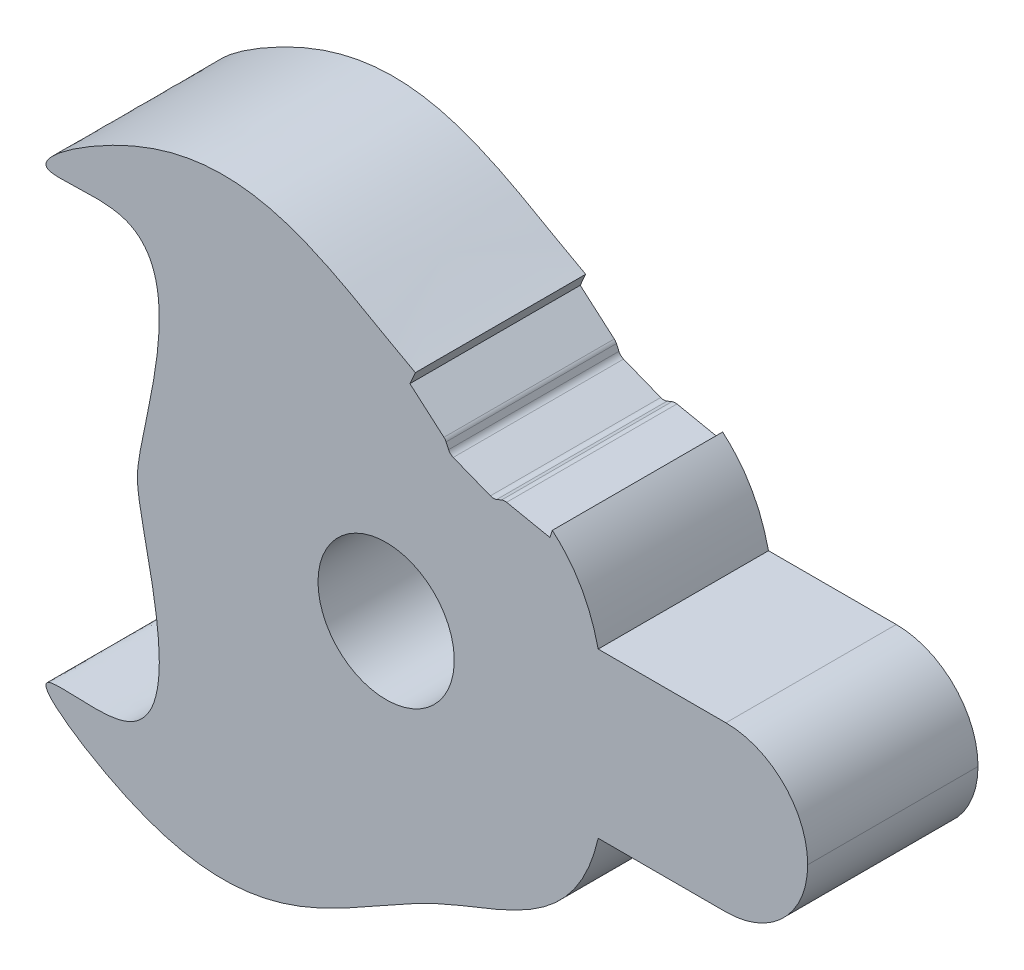
from build123d import *

# Parameters (mm, degrees)
BOSS_EXTRUDE1_DEPTH = 10
MIRROR1_START       = -10
MIRROR1_DEPTH       = 20
CUT_EXTRUDE1_DEPTH  = 79.57532019
FILLET1_R           = 1


# Read off the part's stored shape, not the designer's step: Mirror1
with BuildPart() as part:
    # Sketch1 → Boss-Extrude1 (new, symmetric)
    with BuildSketch(Plane.XY):
        with BuildLine():
            Line((42.41, 9.62), (57.41, 9.62))
            ThreePointArc((57.41, 9.62), (64.198225099, 6.808225099), (67.01, 0.02))
            Line((67.01, 0.02), (25.51, 0.02))
            ThreePointArc((25.51, 0.02), (17.499999992, 8.01999375), (9.510025, 0))
            Line((9.510025, 0), (-11.692847795, 0))
            add(Edge.make_bspline(
                [(-11.692847795, 0), (-11.839277556, 4.894472517), (-2.355639219, 29.34999023), (-27.884478287, 24.143418689), (0.622807134, 43.544120574), (18.657131981, 24.203742691), (39.848963257, 20.777562122), (42.41, 9.62)],
                knots=[0, 0, 0, 0, 0.241060169, 0.319997533, 0.433242816, 0.773278375, 1, 1, 1, 1], degree=3))
        make_face()
    extrude(amount=BOSS_EXTRUDE1_DEPTH, both=True)

    # Mirror1 outline → Mirror1 (add)
    with BuildSketch(Plane.XY.offset(MIRROR1_START)):
        with BuildLine():
            add(Edge.make_bspline(
                [(42.41, -9.62), (39.848963257, -20.777562122), (18.657131981, -24.203742691), (0.914766667, -43.231017215), (-22.484260342, -27.806120254), (-22.43062965, -26.474908489)],
                knots=[0, 0, 0, 0, 0.226721625, 0.566757184, 0.668993837, 0.668993837, 0.668993837, 0.668993837], degree=3))
            Line((42.41, -9.62), (57.41, -9.62))
            ThreePointArc((57.41, -9.62), (64.198225099, -6.808225099), (67.01, -0.02))
            ThreePointArc((67.01, -0.02), (67.009979167, 4.4e-08), (67.01, 0.02))
            Line((67.01, 0.02), (25.51, 0.02))
            ThreePointArc((25.51, 0.02), (17.520000008, -7.97999375), (9.510025, 0))
            Line((9.510025, 0), (-11.692847795, 0))
            add(Edge.make_bspline(
                [(-11.69340369, 0.019999944), (-11.693231778, 0.013308434), (-11.693046499, 0.006641761), (-11.692847795, 0)],
                knots=[0.999672883, 0.999672883, 0.999672883, 0.999672883, 1, 1, 1, 1], degree=3))
            add(Edge.make_bspline(
                [(-11.695042587, -0.13418822), (-11.695226889, -0.081424948), (-11.694688722, -0.030018581), (-11.69340369, 0.019999944)],
                knots=[0.997227707, 0.997227707, 0.997227707, 0.997227707, 0.999672882, 0.999672882, 0.999672882, 0.999672882], degree=3))
            add(Edge.make_bspline(
                [(-9.12723532, -17.435743902), (-9.132715139, -11.176519442), (-11.70604962, -3.23520175), (-11.695042587, -0.13418822)],
                knots=[0.852230655, 0.852230655, 0.852230655, 0.852230655, 0.997849686, 0.997849686, 0.997849686, 0.997849686], degree=3))
            add(Edge.make_bspline(
                [(-22.43062965, -26.474908489), (-22.436909809, -26.313315801), (-21.919544565, -25.3199587), (-11.08123689, -27.530416611), (-9.130740001, -21.42777497), (-9.12723532, -17.435743902)],
                knots=[0.667986412, 0.667986412, 0.667986412, 0.667986412, 0.680002467, 0.758939831, 0.851920313, 0.851920313, 0.851920313, 0.851920313], degree=3))
        make_face()
    extrude(amount=MIRROR1_DEPTH)

    # Sketch2 → Cut-Extrude1 (cut, through all)
    with BuildSketch(Plane.XY.offset(10)):
        Polygon((37.6, 20.83), (36.745678156, 18.13), (31.357208476, 19.231995691), (30.127421317, 18.724063538), (25.012174142, 20.745015378), (24.461632455, 21.956326808), (20.301183061, 25.553639811), (20.94, 26.998739433), align=None)
    extrude(amount=-CUT_EXTRUDE1_DEPTH, mode=Mode.SUBTRACT)

    # Fillet1
    fillet1_edges = [part.edges().sort_by_distance(p)[0] for p in [
        (31.357208476, 19.231995691, 0),
        (30.127421317, 18.724063538, 0),
        (25.012174142, 20.745015378, 0),
        (24.461632455, 21.956326808, 0),
    ]]
    fillet(fillet1_edges, radius=FILLET1_R)


solid = part.part
